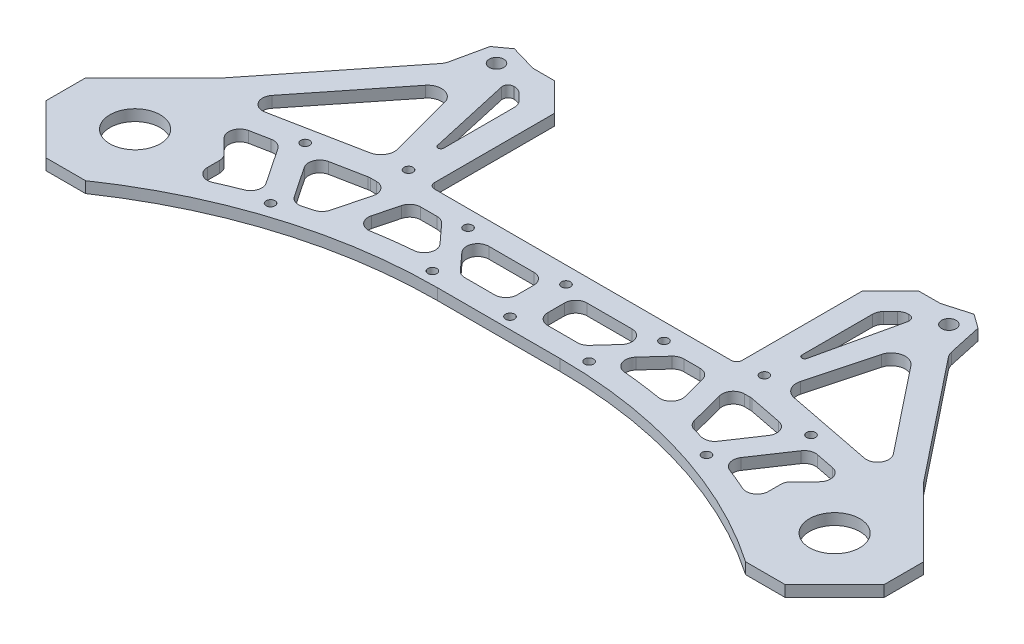
from build123d import *
from OCP.BRepFilletAPI import BRepFilletAPI_MakeChamfer

# Parameters (mm, degrees)
SKETCH_1_R          = 9
EXTRUDE_1_DEPTH     = 4
FILLET_3_R          = 50
CHAMFER_1_SIZE      = 10
FILLET_4_R          = 170
EXTRUDE_START       = -4
SKETCH_2_R          = 2.6
EXTRUDE_2_DEPTH     = 4
CHAMFER_2_SIZE      = 10
CHAMFER_2_SIZE2     = 10.024068518
FILLET_5_R          = 2
FILLET_6_R          = 5
FILLET_7_R          = 5
CUT_EXTRUDE_1_DEPTH = 4
FILLET_8_R          = 4
EXTRUDE_3_DEPTH     = 4
FILLET_9_R          = 1
FILLET_10_R         = 2
FILLET_11_R         = 5
FILLET_12_R         = 5
CUT_EXTRUDE_2_DEPTH = 4
FILLET_13_R         = 4
EXTRUDE_4_DEPTH     = 4
SKETCH_7_R          = 1.6
CUT_EXTRUDE_3_DEPTH = 10


with BuildPart() as part:
    # 草图1 → 凸台-拉伸1 (new body)
    with BuildSketch(Plane(origin=(0, 0, 0), x_dir=(1, 0, 0), z_dir=(0, 1, 0))):
        Polygon((5.303300859, 26.516504294), (0, 31.819805153), (-31.819805153, 0), (0, -31.819805153), (31.819805153, 0), (36.819805153, 5), (213.180194847, 5), (218.180194847, 0), (250, -31.819805153), (281.819805153, 0), (250, 31.819805153), (244.696699141, 26.516504294), (236.213203436, 35), (230, 35), (13.786796564, 35), align=None)
        with Locations(Location((0, 0, 0), (0, 0, 270))):
            Circle(SKETCH_1_R, mode=Mode.SUBTRACT)
        with Locations(Location((250, 0, 0), (0, 0, 270))):
            Circle(SKETCH_1_R, mode=Mode.SUBTRACT)
    extrude(amount=EXTRUDE_1_DEPTH)

    # 圆角3
    # the kernel refuses this fillet: 50 mm, written as the material it takes off along each edge
    with BuildSketch(Plane(origin=(236.213203436, -48.450245762, -35), x_dir=(-1, 0, 0), z_dir=(0, 1, 0))) as fillet_3_piece_1:
        with BuildLine():
            CenterArc((19.380098305, 50), FILLET_3_R, 236.132660747, 33.867339253)
            Line((-8.483495706, 8.483495706), (-9.040767586, 7.65316562))
            ThreePointArc((-9.040767586, 7.65316562), (-4.948854634, 3.534641072), (-0.707106781, -0.707106781))
            Line((-0.707106781, -0.707106781), (0, -1))
            Line((0, -1), (19.380098305, -1))
            Line((19.380098305, -1), (19.380098305, 0))
        make_face()
    extrude(amount=100.900491523, mode=Mode.SUBTRACT)
    with BuildSketch(Plane(origin=(13.786796564, -48.450245762, -35), x_dir=(1, 0, 0), z_dir=(0, 1, 0))) as fillet_3_piece_2:
        with BuildLine():
            CenterArc((19.380098305, -50), FILLET_3_R, 90, 33.867339253)
            Line((-8.483495706, -8.483495706), (-9.040767586, -7.65316562))
            ThreePointArc((-9.040767586, -7.65316562), (-4.948854634, -3.534641072), (-0.707106781, 0.707106781))
            Line((-0.707106781, 0.707106781), (0, 1))
            Line((0, 1), (19.380098305, 1))
            Line((19.380098305, 1), (19.380098305, 0))
        make_face()
    extrude(amount=100.900491523, mode=Mode.SUBTRACT)

    # 倒角1
    chamfer_1_edges = [part.edges().sort_by_distance(p)[0] for p in [
        (281.819805153, 2, 0),
        (250, 2, 31.819805153),
        (0, 2, 31.819805153),
        (-31.819805153, 2, 0),
    ]]
    chamfer(chamfer_1_edges, length=CHAMFER_1_SIZE)

    # 圆角4
    # the kernel refuses this fillet: 170 mm, written as the material it adds along each edge
    with BuildSketch(Plane(origin=(244.696699141, 0, -26.516504294), x_dir=(0.7071067811865487, 0, -0.7071067811865464), z_dir=(0, 1, 0))) as fillet_4_piece_1:
        with BuildLine():
            CenterArc((130.807104298, 117.027167913), FILLET_4_R, 215.157343004, 8.345858433)
            Line((-8.180446561, 19.137123955), (-10.960197579, 17.179323075))
            ThreePointArc((-10.960197579, 17.179323075), (-6.209829397, 8.662505006), (-3.336021383, -0.65647645))
            Line((-3.336021383, -0.65647645), (0, -3.4))
            ThreePointArc((0, -3.4), (3.75, -3.4), (5.033857914, -2.340543358))
            Line((5.033857914, -2.340543358), (7.5, 0))
        make_face()
    extrude(amount=4)
    with BuildSketch(Plane(origin=(5.303300859, 0, -26.516504294), x_dir=(-0.7071067811865499, 0, -0.707106781186545), z_dir=(0, 1, 0))) as fillet_4_piece_2:
        with BuildLine():
            CenterArc((130.807104298, -117.027167913), FILLET_4_R, 136.496798562, 8.345858433)
            Line((-8.180446561, -19.137123955), (-10.960197579, -17.179323075))
            ThreePointArc((-10.960197579, -17.179323075), (-6.209829397, -8.662505006), (-3.336021383, 0.65647645))
            Line((-3.336021383, 0.65647645), (0, 3.4))
            ThreePointArc((0, 3.4), (3.75, 3.4), (5.033857914, 2.340543358))
            Line((5.033857914, 2.340543358), (7.5, 0))
        make_face()
    extrude(amount=4)
    with BuildSketch(Plane(origin=(213.180194847, 0, -5), x_dir=(0.7071067811865461, 0, 0.707106781186549), z_dir=(0, 1, 0))) as fillet_4_piece_3:
        with BuildLine():
            CenterArc((73.311428823, -167.104876781), FILLET_4_R, 100.589244362, 34.410755638)
            Line((-46.896723979, -46.896723979), (-49.300887035, -44.492560923))
            Line((-49.300887035, -44.492560923), (-2.404163056, 2.404163056))
            Line((-2.404163056, 2.404163056), (0, 3.4))
            ThreePointArc((0, 3.4), (21.035533906, 3.4), (41.446260592, 3.342097536))
            Line((41.446260592, 3.342097536), (42.071067812, 0))
        make_face()
    extrude(amount=4)
    with BuildSketch(Plane(origin=(36.819805153, 0, -5), x_dir=(1, 0, 0), z_dir=(0, 1, 0))) as fillet_4_piece_4:
        with BuildLine():
            CenterArc((66.321983082, -170), FILLET_4_R, 90, 34.410755638)
            Line((-29.748737342, -29.748737342), (-31.67015175, -26.943712088))
            ThreePointArc((-31.67015175, -26.943712088), (-17.278531727, -12.470205615), (-2.404163056, 2.404163056))
            Line((-2.404163056, 2.404163056), (0, 3.4))
            Line((0, 3.4), (66.321983082, 3.4))
            Line((66.321983082, 3.4), (66.321983082, 0))
        make_face()
    extrude(amount=4)

    # 草图2 → 凸台-拉伸2 (add)
    # profile 1 of 2: a face of its own
    with BuildSketch(Plane(origin=(0, 4, 0), x_dir=(1, 0, 0), z_dir=(0, 1, 0)).offset(EXTRUDE_START)):
        with BuildLine():
            Line((33.166894869, 35), (70, 35))
            Line((70, 35), (70, 89.938046945))
            Line((70, 89.938046945), (52.173767708, 89.980797886))
            Line((52.173767708, 89.980797886), (45.293317142, 91.980771652))
            Line((45.293317142, 91.980771652), (41.239720179, 89.053596963))
            Line((41.239720179, 89.053596963), (37.186123217, 86.126422273))
            Line((37.186123217, 86.126422273), (34.934162449, 75.803316969))
            Line((34.934162449, 75.803316969), (0, 31.819805153))
            ThreePointArc((0, 31.819805153), (12.354394119, 32.593454654), (24.619740216, 34.264045178))
            ThreePointArc((24.619740216, 34.264045178), (28.877504407, 34.815671525), (33.166894869, 35))
        make_face()
        with Locations(Location((44.166894869, 85, 0), (0, 0, 270))):
            Circle(SKETCH_2_R, mode=Mode.SUBTRACT)
    # profile 2 of 2: a face of its own
    with BuildSketch(Plane(origin=(0, 4, 0), x_dir=(1, 0, 0), z_dir=(0, 1, 0)).offset(EXTRUDE_START)):
        with BuildLine():
            Line((180, 89.938046945), (197.826232292, 89.980797886))
            Line((197.826232292, 89.980797886), (204.706682858, 91.980771652))
            Line((204.706682858, 91.980771652), (208.760279821, 89.053596963))
            Line((208.760279821, 89.053596963), (212.813876783, 86.126422273))
            Line((212.813876783, 86.126422273), (215.065837551, 75.803316969))
            Line((215.065837551, 75.803316969), (250, 31.819805153))
            ThreePointArc((250, 31.819805153), (237.645605881, 32.593454654), (225.380259784, 34.264045178))
            ThreePointArc((225.380259784, 34.264045178), (221.122495593, 34.815671525), (216.833105131, 35))
            Line((216.833105131, 35), (180, 35))
            Line((180, 35), (180, 89.938046945))
        make_face()
        with Locations(Location((205.833105131, 85, 0), (0, 0, 270))):
            Circle(SKETCH_2_R, mode=Mode.SUBTRACT)
    extrude(amount=EXTRUDE_2_DEPTH)

    # 倒角2: one chamfer whose edges measure the first distance from different faces: ONE call of the kernel's chamfer builder (chamfer() names one face for all edges)
    chamfer_2_edges_1 = [part.edges().sort_by_distance(p)[0] for p in [
        (70, 2, -89.938046945),
    ]]
    chamfer_2_side_1 = [part.faces().sort_by_distance(p)[0] for p in [
        (61.086883854, 2, -89.959422415),
    ]]
    chamfer_2_edges_2 = [part.edges().sort_by_distance(p)[0] for p in [
        (180, 2, -89.938046945),
    ]]
    chamfer_2_side_2 = [part.faces().sort_by_distance(p)[0] for p in [
        (180, 2, -62.469023472),
    ]]
    chamfer_2 = BRepFilletAPI_MakeChamfer(part.part.solid().wrapped)
    for e in chamfer_2_edges_1:
        chamfer_2.Add(CHAMFER_2_SIZE, CHAMFER_2_SIZE2, e.wrapped, chamfer_2_side_1[0].wrapped)  # the first distance lies on this face
    for e in chamfer_2_edges_2:
        chamfer_2.Add(CHAMFER_2_SIZE, CHAMFER_2_SIZE2, e.wrapped, chamfer_2_side_2[0].wrapped)  # the first distance lies on this face
    add(Compound.cast(chamfer_2.Shape()), mode=Mode.REPLACE)

    # 圆角5
    fillet_5_edges = [part.edges().sort_by_distance(p)[0] for p in [
        (70, 2, -35),
        (180, 2, -35),
    ]]
    fillet(fillet_5_edges, radius=FILLET_5_R)

    # 圆角6
    fillet_6_edges = [part.edges().sort_by_distance(p)[0] for p in [
        (34.934162449, 2, -75.803316969),
        (52.173767708, 2, -89.980797886),
        (197.826232292, 2, -89.980797886),
    ]]
    fillet(fillet_6_edges, radius=FILLET_6_R)

    # 圆角7
    fillet_7_edges = [part.edges().sort_by_distance(p)[0] for p in [
        (215.065837551, 2, -75.803316969),
        (250, 2, -31.819805153),
        (0, 2, -31.819805153),
    ]]
    fillet(fillet_7_edges, radius=FILLET_7_R)

    # 草图3 → 切除-拉伸1 (cut)
    with BuildSketch(Plane(origin=(0, 4, 0), x_dir=(1, 0, 0), z_dir=(0, 1, 0))):
        with BuildLine():
            Line((41.259386856, 69.296377147), (7.225235257, 26.446015094))
            Line((7.225235257, 26.446015094), (61, 37))
            Line((61, 37), (61, 76.198693589))
            Line((61, 76.198693589), (56.250533642, 80.970995088))
            Line((56.250533642, 80.970995088), (52.858019294, 80.97913103))
            Line((52.858019294, 80.97913103), (50.555655273, 80.97913103))
            Line((50.555655273, 80.97913103), (44.287501238, 76.452785166))
            Line((44.287501238, 76.452785166), (43.97489109, 75.019763986))
            ThreePointArc((43.97489109, 75.019763986), (42.945115806, 72.002459474), (41.259386856, 69.296377147))
        make_face()
        with BuildLine():
            Line((189, 37), (242.774764743, 26.446015094))
            Line((242.774764743, 26.446015094), (208.740613144, 69.296377147))
            ThreePointArc((208.740613144, 69.296377147), (207.054884194, 72.002459474), (206.02510891, 75.019763986))
            Line((206.02510891, 75.019763986), (205.712498762, 76.452785166))
            Line((205.712498762, 76.452785166), (199.444344727, 80.97913103))
            Line((199.444344727, 80.97913103), (197.141980706, 80.97913103))
            Line((197.141980706, 80.97913103), (193.749466358, 80.970995088))
            Line((193.749466358, 80.970995088), (189, 76.198693589))
            Line((189, 76.198693589), (189, 37))
        make_face()
    extrude(amount=-CUT_EXTRUDE_1_DEPTH, mode=Mode.SUBTRACT)

    # 圆角8
    fillet_8_edges = [part.edges().sort_by_distance(p)[0] for p in [
        (44.287501238, 2, -76.452785166),
        (50.555655273, 2, -80.97913103),
        (56.250533642, 2, -80.970995088),
        (61, 2, -76.198693589),
        (205.712498762, 2, -76.452785166),
        (199.444344727, 2, -80.97913103),
        (193.749466358, 2, -80.970995088),
        (189, 2, -76.198693589),
        (189, 2, -37),
        (61, 2, -37),
        (242.774764743, 2, -26.446015094),
        (7.225235257, 2, -26.446015094),
    ]]
    fillet(fillet_8_edges, radius=FILLET_8_R)

    # 草图4 → 凸台-拉伸3 (add)
    with BuildSketch(Plane(origin=(0, 4, 0), x_dir=(1, 0, 0), z_dir=(0, 1, 0)).offset(EXTRUDE_START)):
        with BuildLine():
            Line((51.848920128, 80.97913103), (61, 40.291259126))
            ThreePointArc((61, 40.291259126), (60.088803858, 37.749745654), (57.770354637, 36.366140818))
            Line((57.770354637, 36.366140818), (54.449523221, 35.714385207))
            Line((54.449523221, 35.714385207), (43.964320121, 74.971711752))
            ThreePointArc((43.964320121, 74.971711752), (44.527575965, 76.303685257), (45.527650977, 77.348319419))
            Line((45.527650977, 77.348319419), (49.507180376, 80.2220086))
            ThreePointArc((49.507180376, 80.2220086), (50.618373558, 80.785146681), (51.848920128, 80.97913103))
        make_face()
        with BuildLine():
            Line((200.492819624, 80.2220086), (204.472349023, 77.348319419))
            ThreePointArc((204.472349023, 77.348319419), (205.472424035, 76.303685257), (206.035679879, 74.971711752))
            Line((206.035679879, 74.971711752), (195.550476779, 35.714385207))
            Line((195.550476779, 35.714385207), (192.229645363, 36.366140818))
            ThreePointArc((192.229645363, 36.366140818), (189.911196142, 37.749745654), (189, 40.291259126))
            Line((189, 40.291259126), (198.151079872, 80.97913103))
            ThreePointArc((198.151079872, 80.97913103), (199.381626442, 80.785146681), (200.492819624, 80.2220086))
        make_face()
    extrude(amount=EXTRUDE_3_DEPTH)

    # 圆角9
    fillet_9_edges = [part.edges().sort_by_distance(p)[0] for p in [
        (61, 2, -40.291259126),
        (189, 2, -40.291259126),
    ]]
    fillet(fillet_9_edges, radius=FILLET_9_R)

    # 圆角10
    fillet_10_edges = [part.edges().sort_by_distance(p)[0] for p in [
        (198.151079872, 2, -80.97913103),
        (51.848920128, 2, -80.97913103),
    ]]
    fillet(fillet_10_edges, radius=FILLET_10_R)

    # 圆角11
    fillet_11_edges = [part.edges().sort_by_distance(p)[0] for p in [
        (54.449523221, 2, -35.714385207),
        (195.550476779, 2, -35.714385207),
    ]]
    fillet(fillet_11_edges, radius=FILLET_11_R)

    # 圆角12
    fillet_12_edges = [part.edges().sort_by_distance(p)[0] for p in [
        (206.035679879, 2, -74.971711752),
        (43.964320121, 2, -74.971711752),
    ]]
    fillet(fillet_12_edges, radius=FILLET_12_R)

    # 草图5 → 切除-拉伸2 (cut)
    with BuildSketch(Plane(origin=(0, 4, 0), x_dir=(1, 0, 0), z_dir=(0, 1, 0))):
        with BuildLine():
            Line((15.909902577, 15.909902577), (24.748737342, 7.071067812))
            Line((24.748737342, 7.071067812), (24.748737342, -5.192210542))
            ThreePointArc((24.748737342, -5.192210542), (28.927157936, -3.209429664), (33.155682585, -1.335877432))
            ThreePointArc((33.155682585, -1.335877432), (38.014593044, 0.657624172), (42.930201119, 2.506909639))
            Line((42.930201119, 2.506909639), (30.021707866, 21.748416151))
            Line((30.021707866, 21.748416151), (19.615917239, 19.706146738))
            Line((19.615917239, 19.706146738), (13.344503517, 18.475301637))
            Line((13.344503517, 18.475301637), (15.909902577, 15.909902577))
        make_face()
        Polygon((119.508786035, 13), (103.141788235, 13), (90.377446657, 27), (119.508786035, 27), align=None)
        with BuildLine():
            Line((64.389814038, 27), (56.779628076, 27))
            Line((56.779628076, 27), (50.935131692, 25.852942883))
            Line((50.935131692, 25.852942883), (38.67511093, 23.446757106))
            Line((38.67511093, 23.446757106), (50.935131692, 5.17186904))
            ThreePointArc((50.935131692, 5.17186904), (55.118149765, 6.399329485), (59.329972774, 7.523983336))
            Line((59.329972774, 7.523983336), (64.389814038, 27))
        make_face()
        with BuildLine():
            Line((72, 27), (82.680829438, 27))
            Line((82.680829438, 27), (95.591244807, 12.839785464))
            ThreePointArc((95.591244807, 12.839785464), (81.437612992, 11.671810929), (67.4221425, 9.379204347))
            Line((67.4221425, 9.379204347), (72, 27))
        make_face()
        Polygon((159.622553343, 27), (130.491213965, 27), (130.491213965, 13), (146.858211765, 13), align=None)
        with BuildLine():
            Line((211.32488907, 23.446757106), (199.064868308, 25.852942883))
            Line((199.064868308, 25.852942883), (193.220371924, 27))
            Line((193.220371924, 27), (185.610185962, 27))
            Line((185.610185962, 27), (190.670027226, 7.523983336))
            ThreePointArc((190.670027226, 7.523983336), (194.881850235, 6.399329485), (199.064868308, 5.17186904))
            Line((199.064868308, 5.17186904), (211.32488907, 23.446757106))
        make_face()
        with BuildLine():
            Line((207.069798881, 2.506909639), (219.978292134, 21.748416151))
            Line((219.978292134, 21.748416151), (230.384082761, 19.706146738))
            Line((230.384082761, 19.706146738), (236.655496483, 18.475301637))
            Line((236.655496483, 18.475301637), (234.090097423, 15.909902577))
            Line((234.090097423, 15.909902577), (225.251262658, 7.071067812))
            Line((225.251262658, 7.071067812), (225.251262658, -5.192210542))
            ThreePointArc((225.251262658, -5.192210542), (221.072842064, -3.209429664), (216.844317415, -1.335877432))
            ThreePointArc((216.844317415, -1.335877432), (211.985406956, 0.657624172), (207.069798881, 2.506909639))
        make_face()
        with BuildLine():
            Line((178, 27), (182.5778575, 9.379204347))
            ThreePointArc((182.5778575, 9.379204347), (168.562387008, 11.671810929), (154.408755193, 12.839785464))
            Line((154.408755193, 12.839785464), (167.319170562, 27))
            Line((167.319170562, 27), (178, 27))
        make_face()
    extrude(amount=-CUT_EXTRUDE_2_DEPTH, mode=Mode.SUBTRACT)

    # 圆角13
    fillet_13_edges = [part.edges().sort_by_distance(p)[0] for p in [
        (13.344503517, 2, -18.475301637),
        (30.021707866, 2, -21.748416151),
        (42.930201119, 2, -2.506909639),
        (24.748737342, 2, 5.192210542),
        (24.748737342, 2, -7.071067812),
        (56.779628076, 2, -27),
        (64.389814038, 2, -27),
        (59.329972774, 2, -7.523983336),
        (50.935131692, 2, -5.17186904),
        (38.67511093, 2, -23.446757106),
        (67.4221425, 2, -9.379204347),
        (72, 2, -27),
        (82.680829438, 2, -27),
        (95.591244807, 2, -12.839785464),
        (146.858211765, 2, -13),
        (130.491213965, 2, -13),
        (130.491213965, 2, -27),
        (159.622553343, 2, -27),
        (167.319170562, 2, -27),
        (178, 2, -27),
        (182.5778575, 2, -9.379204347),
        (154.408755193, 2, -12.839785464),
        (103.141788235, 2, -13),
        (90.377446657, 2, -27),
        (119.508786035, 2, -27),
        (119.508786035, 2, -13),
        (225.251262658, 2, -7.071067812),
        (225.251262658, 2, 5.192210542),
        (207.069798881, 2, -2.506909639),
        (219.978292134, 2, -21.748416151),
        (236.655496483, 2, -18.475301637),
        (199.064868308, 2, -5.17186904),
        (190.670027226, 2, -7.523983336),
        (185.610185962, 2, -27),
        (193.220371924, 2, -27),
        (211.32488907, 2, -23.446757106),
    ]]
    fillet(fillet_13_edges, radius=FILLET_13_R)

    # 草图6 → 凸台-拉伸4 (add)
    with BuildSketch(Plane(origin=(0, 4, 0), x_dir=(1, 0, 0), z_dir=(0, 1, 0))):
        Polygon((37.186123217, 86.126422273), (37.824908007, 89.054644979), (42.857532511, 92.688792925), (45.293317142, 91.980771652), align=None)
        Polygon((212.175091993, 89.054644979), (207.142467489, 92.688792925), (204.706682858, 91.980771652), (212.813876783, 86.126422273), align=None)
    extrude(amount=-EXTRUDE_4_DEPTH)

    # 草图7 → 切除-拉伸3 (cut)
    with BuildSketch(Plane(origin=(0, 4, 0), x_dir=(1, 0, 0), z_dir=(0, 1, 0))):
        with Locations(Location((34.609562391, 26.172761135, 0), (0, 0, 270))):
            Circle(SKETCH_7_R)
        with Locations(Location((47.113684451, 1.312769582, 0), (0, 0, 270))):
            Circle(SKETCH_7_R)
        with Locations(Location((97, 9.255699158, 0), (0, 0, 270))):
            Circle(SKETCH_7_R)
        with Locations(Location((125, 29, 0), (0, 0, 270))):
            Circle(SKETCH_7_R)
        with Locations(Location((125, 9, 0), (0, 0, 270))):
            Circle(SKETCH_7_R)
        with Locations(Location((61.416561737, 36.309705645, 0), (0, 0, 270))):
            Circle(SKETCH_7_R)
        with Locations(Location((188.583438263, 36.309705645, 0), (0, 0, 270))):
            Circle(SKETCH_7_R)
        with Locations(Location((153, 9.255699158, 0), (0, 0, 270))):
            Circle(SKETCH_7_R)
        with Locations(Location((202.886315549, 1.312769582, 0), (0, 0, 270))):
            Circle(SKETCH_7_R)
        with Locations(Location((215.390437609, 26.172761135, 0), (0, 0, 270))):
            Circle(SKETCH_7_R)
        with Locations(Location((90, 29, 0), (0, 0, 270))):
            Circle(SKETCH_7_R)
        with Locations(Location((160, 29, 0), (0, 0, 270))):
            Circle(SKETCH_7_R)
    extrude(amount=-CUT_EXTRUDE_3_DEPTH, mode=Mode.SUBTRACT)


solid = part.part
